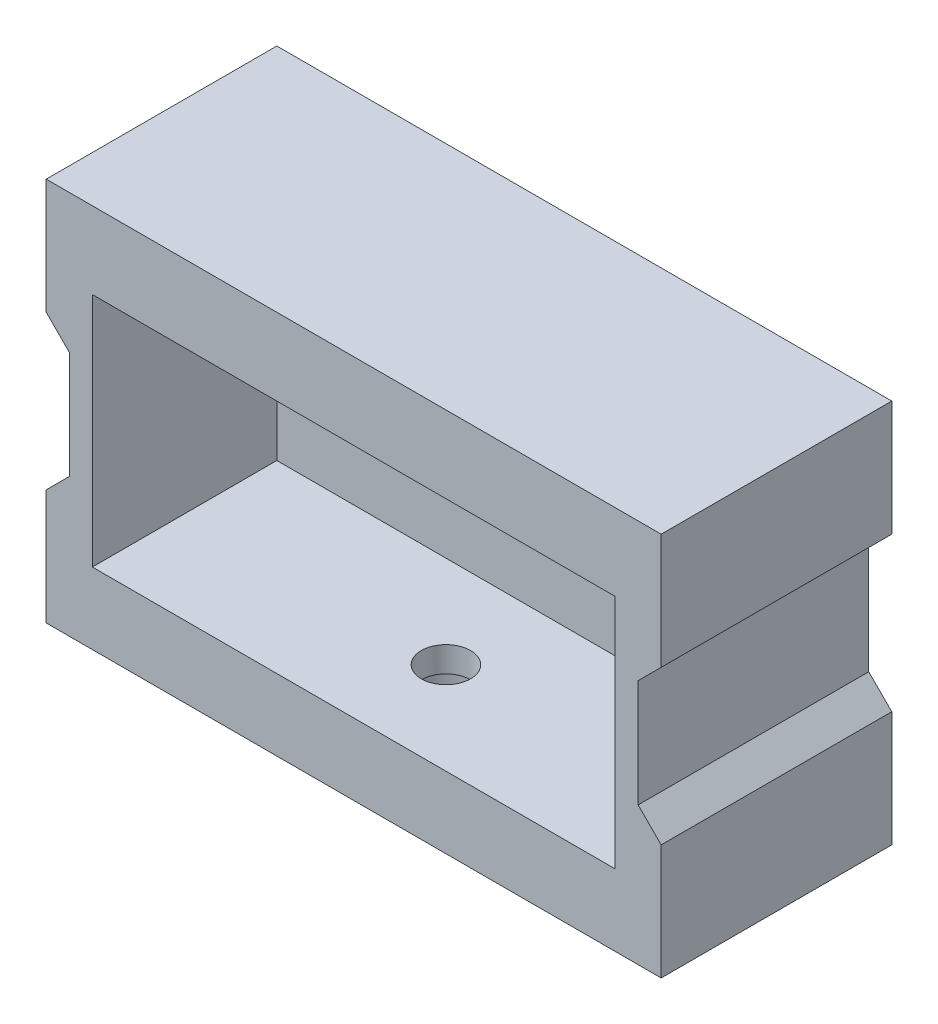
from build123d import *

# Parameters (mm, degrees)
SKETCH1_W               = 80
SKETCH1_H               = 50
BOSS_EXTRUDE1_DEPTH     = 30
CUT_EXTRUDE1_DEPTH      = 56.901699437
CUT_EXTRUDE1_DEPTH_BACK = 56.901699437
SKETCH2_W               = 6
SKETCH2_H               = 20
CHAMFER1_SIZE           = 3
CUT_EXTRUDE2_START      = 30
SKETCH3_W               = 68
SKETCH3_H               = 30
CUT_EXTRUDE2_DEPTH      = 24
SKETCH4_R               = 3.2
CUT_EXTRUDE3_DEPTH      = 56.901699437
CUT_EXTRUDE4_DEPTH      = 56.901699437
CUT_EXTRUDE4_DEPTH_BACK = 56.901699437
SKETCH5_R               = 1.75
CUT_EXTRUDE5_START      = 6
CUT_EXTRUDE5_DEPTH      = 3
CUT_EXTRUDE6_START      = -25
SKETCH7_R               = 5.25
CUT_EXTRUDE6_DEPTH      = 6
CUT_EXTRUDE8_START      = 30
SKETCH10_W              = 68
SKETCH10_H              = 0.7
CUT_EXTRUDE8_DEPTH      = 24


with BuildPart() as part:
    # Sketch1 → Boss-Extrude1 (new body)
    with BuildSketch(Plane.XY):
        Rectangle(SKETCH1_W, SKETCH1_H)
    extrude(amount=BOSS_EXTRUDE1_DEPTH)

    # Sketch2 → Cut-Extrude1 (cut, two sides: drawn at the far end of the back side and taken through both)
    with BuildSketch(Plane.XY.offset(-CUT_EXTRUDE1_DEPTH_BACK)):
        with Locations((-40, 0)):
            Rectangle(SKETCH2_W, SKETCH2_H)
        with Locations((40, 0)):
            Rectangle(SKETCH2_W, SKETCH2_H)
    extrude(amount=CUT_EXTRUDE1_DEPTH + CUT_EXTRUDE1_DEPTH_BACK, mode=Mode.SUBTRACT)

    # Chamfer1
    chamfer1_edges = [part.edges().sort_by_distance(p)[0] for p in [
        (37, 10, 15),
        (37, -10, 15),
        (-37, -10, 15),
        (-37, 10, 15),
    ]]
    chamfer(chamfer1_edges, length=CHAMFER1_SIZE - 0.0001)  # a hair under: the kernel refuses the full size

    # Sketch3 → Cut-Extrude2 (cut)
    with BuildSketch(Plane.XY.offset(CUT_EXTRUDE2_START)):
        Rectangle(SKETCH3_W, SKETCH3_H)
    extrude(amount=-CUT_EXTRUDE2_DEPTH, mode=Mode.SUBTRACT)

    # Sketch4 → Cut-Extrude3 (cut, through all)
    with BuildSketch(Plane(origin=(0, 0, 0), x_dir=(1, 0, 0), z_dir=(0, 1, 0))):
        with Locations(Location((0, -18, 0), (0, 0, 270))):
            Circle(SKETCH4_R)
    extrude(amount=-CUT_EXTRUDE3_DEPTH, mode=Mode.SUBTRACT)

    # Sketch5 → Cut-Extrude4 (cut, two sides: drawn at the far end of the back side and taken through both)
    with BuildSketch(Plane.XY.offset(-CUT_EXTRUDE4_DEPTH_BACK)):
        with Locations(Location((27, 0, 0), (0, 0, 180))):
            Circle(SKETCH5_R)
        with Locations(Location((-27, 0, 0), (0, 0, 180))):
            Circle(SKETCH5_R)
    extrude(amount=CUT_EXTRUDE4_DEPTH + CUT_EXTRUDE4_DEPTH_BACK, mode=Mode.SUBTRACT)

    # Sketch6 → Cut-Extrude5 (cut)
    with BuildSketch(Plane.XY.offset(CUT_EXTRUDE5_START)):
        Polygon((-23.535898385, 0), (-25.267949192, 3), (-28.732050808, 3), (-30.464101615, 0), (-28.732050808, -3), (-25.267949192, -3), align=None)
        Polygon((30.464101615, 0), (28.732050808, 3), (25.267949192, 3), (23.535898385, 0), (25.267949192, -3), (28.732050808, -3), align=None)
    extrude(amount=-CUT_EXTRUDE5_DEPTH, mode=Mode.SUBTRACT)

    # Sketch7 → Cut-Extrude6 (cut)
    with BuildSketch(Plane(origin=(0, 0, 0), x_dir=(1, 0, 0), z_dir=(0, 1, 0)).offset(CUT_EXTRUDE6_START)):
        with Locations(Location((0, -18, 0), (0, 0, 270))):
            Circle(SKETCH7_R)
    extrude(amount=CUT_EXTRUDE6_DEPTH, mode=Mode.SUBTRACT)

    # Sketch10 → Cut-Extrude8 (cut)
    with BuildSketch(Plane.XY.offset(CUT_EXTRUDE8_START)):
        with Locations((0, -15.35)):
            Rectangle(SKETCH10_W, SKETCH10_H)
    extrude(amount=-CUT_EXTRUDE8_DEPTH, mode=Mode.SUBTRACT)


solid = part.part
